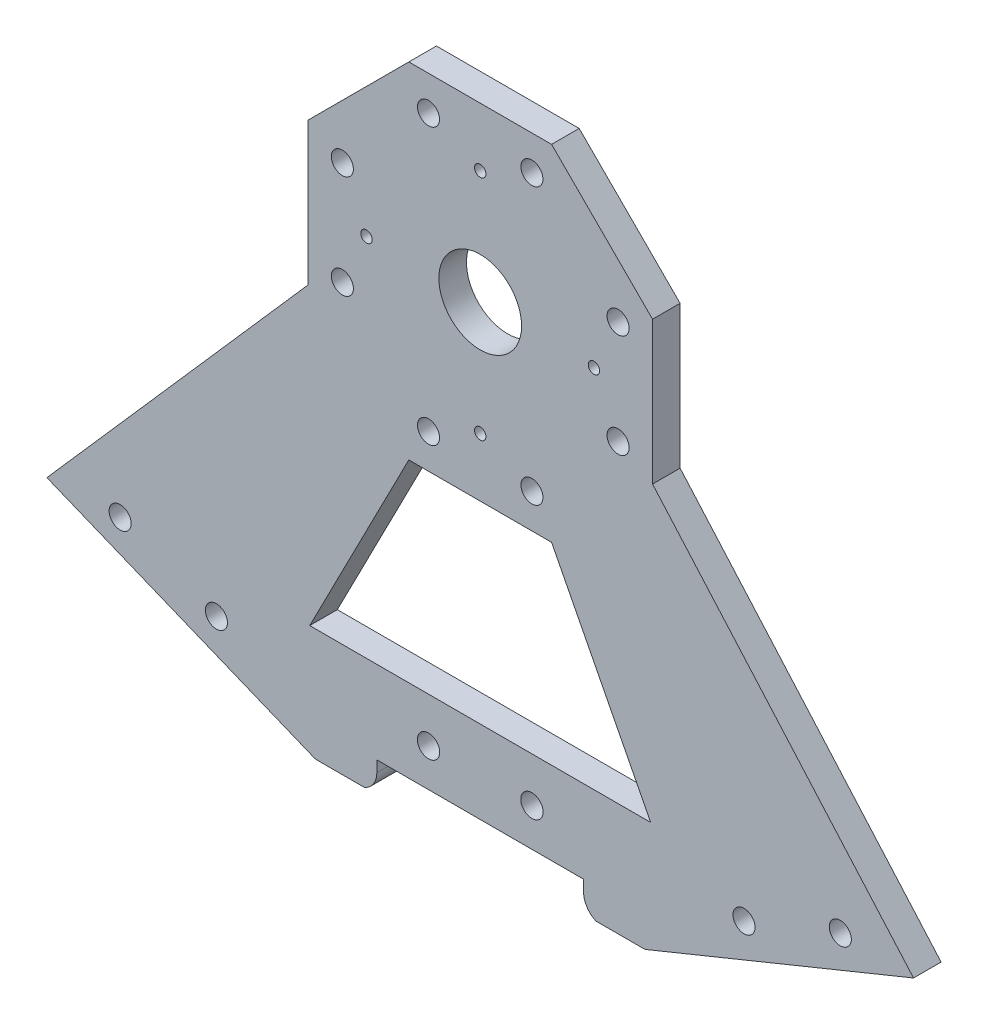
from build123d import *

# Parameters (mm, degrees)
SKETCH_2_R           = 0.825
SKETCH_2_R_2         = 6
EXTRUDE_1_DEPTH      = 2
SKETCH_4_R           = 1.6
CUT_EXTRUDE_1_DEPTH  = 15
EXTRUDE_2_DEPTH      = 2
EXTRUDE_3_DEPTH      = 2
SKETCH_21_W          = 94.174920184
SKETCH_21_H          = 20
EXTRUDE_5_DEPTH      = 4
CUT_EXTRUDE_10_DEPTH = 7
SKETCH_23_W          = 30
SKETCH_23_H          = 8.450093073
CUT_EXTRUDE_11_DEPTH = 7
CHAMFER_START        = -2
CHAMFER_6_DEPTH      = 4
SKETCH_25_R          = 1.6
CUT_EXTRUDE_12_DEPTH = 7
FILLET_3_R           = 3
CUT_EXTRUDE_13_DEPTH = 32
SKETCH_27_R          = 1.621448002
CUT_EXTRUDE_14_DEPTH = 32


with BuildPart() as part:
    # 草图2 → 凸台-拉伸1 (new, symmetric)
    with BuildSketch(Plane.XY):
        Polygon((10.355339059, 25), (-10.355339059, 25), (-25, 10.355339059), (-25, -10.355339059), (-10.355339059, -25), (10.355339059, -25), (25, -10.355339059), (25, 10.355339059), align=None)
        with Locations((-16.5, 0)):
            Circle(SKETCH_2_R, mode=Mode.SUBTRACT)
        with Locations((0, 16.5)):
            Circle(SKETCH_2_R, mode=Mode.SUBTRACT)
        with Locations((16.5, 0)):
            Circle(SKETCH_2_R, mode=Mode.SUBTRACT)
        with Locations((0, -16.5)):
            Circle(SKETCH_2_R, mode=Mode.SUBTRACT)
        Circle(SKETCH_2_R_2, mode=Mode.SUBTRACT)
    extrude(amount=EXTRUDE_1_DEPTH, both=True)

    # 草图4 → 切除-拉伸1 (cut)
    with BuildSketch(Plane(origin=(0, 0, -2), x_dir=(-1, 0, 0), z_dir=(0, 0, -1))):
        with Locations((-7.5, -20)):
            Circle(SKETCH_4_R)
        with Locations(Location((7.5, -20, 0), (0, 0, 180))):
            Circle(SKETCH_4_R)
        with Locations((-20, 7.5)):
            Circle(SKETCH_4_R)
        with Locations(Location((-20, -7.5, 0), (0, 0, 180))):
            Circle(SKETCH_4_R)
        with Locations((7.5, 20)):
            Circle(SKETCH_4_R)
        with Locations(Location((-7.5, 20, 0), (0, 0, 180))):
            Circle(SKETCH_4_R)
        with Locations((20, -7.5)):
            Circle(SKETCH_4_R)
        with Locations(Location((20, 7.5, 0), (0, 0, 180))):
            Circle(SKETCH_4_R)
    extrude(amount=-CUT_EXTRUDE_1_DEPTH, mode=Mode.SUBTRACT)

    # 草图5 → 凸台-拉伸2 (add, symmetric)
    with BuildSketch(Plane.XY):
        Polygon((-25, -10.355339059), (-80, -73), (-60, -73), (-11.17766953, -24.17766953), align=None)
        Polygon((60, -73), (80, -73), (25, -10.355339059), (11.17766953, -24.17766953), align=None)
    extrude(amount=EXTRUDE_2_DEPTH, both=True)

    # 草图6 → 凸台-拉伸3 (add, symmetric)
    with BuildSketch(Plane.XY):
        Polygon((-60, -73), (-35, -73), (-10.355339059, -25), (-11.17766953, -24.17766953), align=None)
        Polygon((60, -73), (11.17766953, -24.17766953), (10.355339059, -25), (35, -73), align=None)
    extrude(amount=EXTRUDE_3_DEPTH, both=True)

    # 草图21 → 凸台-拉伸5 (add)
    with BuildSketch(Plane.XY.offset(2)):
        with Locations((0, -63)):
            Rectangle(SKETCH_21_W, SKETCH_21_H)
    extrude(amount=-EXTRUDE_5_DEPTH)

    # 草图22 → 切除-拉伸10 (cut, symmetric)
    with BuildSketch(Plane.XY.offset(2)):
        with BuildLine():
            Line((-72.098289103, -64), (-93.602322684, -86.771790357))
            Line((-93.602322684, -86.771790357), (107.138572214, -85.642128596))
            Line((107.138572214, -85.642128596), (72.098289103, -64))
            add(Edge.make_bspline(
                [(-72.098289103, -64), (0, -76), (72.098289103, -64)],
                knots=[0, 0, 0, 1, 1, 1], degree=2))
        make_face()
    extrude(amount=CUT_EXTRUDE_10_DEPTH, both=True, mode=Mode.SUBTRACT)

    # 草图23 → 切除-拉伸11 (cut, symmetric)
    with BuildSketch(Plane.XY.offset(2)):
        with Locations((0, -69.225046537)):
            Rectangle(SKETCH_23_W, SKETCH_23_H)
    extrude(amount=CUT_EXTRUDE_11_DEPTH, both=True, mode=Mode.SUBTRACT)

    # 倒角6: read off the stored shape, not the designer's step
    # 倒角6 outline → 倒角6 (cut)
    with BuildSketch(Plane.XY.offset(CHAMFER_START)):
        with BuildLine():
            Line((72.098289103, -64), (62.861553298, -53.47941486))
            Line((62.861553298, -53.47941486), (23.982189464, -69.336136194))
            add(Edge.make_bspline(
                [(72.098289103, -64), (48.040239283, -68.004208719), (23.982189464, -69.336136194)],
                knots=[0, 0, 0, 0.33368406, 0.33368406, 0.33368406], degree=2))
        make_face()
        with BuildLine():
            Line((-23.982189464, -69.336136194), (-62.861553298, -53.47941486))
            Line((-62.861553298, -53.47941486), (-72.098289103, -64))
            add(Edge.make_bspline(
                [(-23.982189464, -69.336136194), (-48.040239283, -68.004208719), (-72.098289103, -64)],
                knots=[0.66631594, 0.66631594, 0.66631594, 1, 1, 1], degree=2))
        make_face()
    extrude(amount=CHAMFER_6_DEPTH, mode=Mode.SUBTRACT)

    # 草图25 → 切除-拉伸12 (cut, symmetric)
    with BuildSketch(Plane.XY.offset(2)):
        with Locations((-52.235249282, -53.148500686)):
            Circle(SKETCH_25_R)
        with Locations((-38.268733006, -58.619919434)):
            Circle(SKETCH_25_R)
        with Locations((38.268733006, -58.619919434)):
            Circle(SKETCH_25_R)
        with Locations((52.235249282, -53.148500686)):
            Circle(SKETCH_25_R)
    extrude(amount=CUT_EXTRUDE_12_DEPTH, both=True, mode=Mode.SUBTRACT)

    # 圆角3
    fillet_3_edges = [part.edges().sort_by_distance(p)[0] for p in [
        (-15, -69.740292883, -3e-07),
        (15, -69.740292883, -3e-07),
    ]]
    fillet(fillet_3_edges, radius=FILLET_3_R)

    # 草图26 → 切除-拉伸13 (cut, symmetric)
    with BuildSketch(Plane(origin=(0, 0, 0), x_dir=(0, 0, -1), z_dir=(1, 0, 0))):
        with BuildLine():
            Line((-2, -69.366736418), (-2.263749967, -70.210945681))
            Line((-2.263749967, -70.210945681), (2.547301332, -70.18897741))
            Line((2.547301332, -70.18897741), (2, -69.366736418))
            add(Edge.make_bspline(
                [(-2, -69.366736418), (0, -69.686845507), (2, -69.366736418)],
                knots=[0, 0, 0, 1, 1, 1], degree=2))
        make_face()
    extrude(amount=CUT_EXTRUDE_13_DEPTH, both=True, mode=Mode.SUBTRACT)

    # 草图27 → 切除-拉伸14 (cut, symmetric)
    with BuildSketch(Plane(origin=(0, 0, -2), x_dir=(-1, 0, 0), z_dir=(0, 0, -1))):
        with Locations(Location((-7.5, -59.5, 0), (0, 0, 180))):
            Circle(SKETCH_27_R)
        with Locations(Location((7.5, -59.5, 0), (0, 0, 180))):
            Circle(SKETCH_27_R)
    extrude(amount=CUT_EXTRUDE_14_DEPTH, both=True, mode=Mode.SUBTRACT)


solid = part.part
